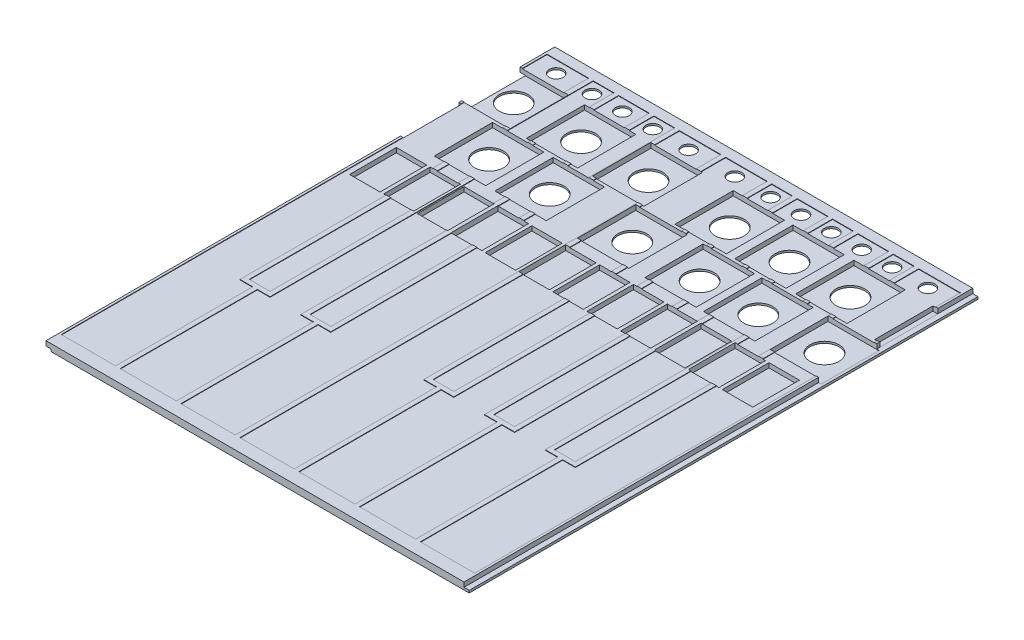
from build123d import *
from OCP.BRepAlgoAPI import BRepAlgoAPI_Cut
from OCP.TopTools import TopTools_ListOfShape

# Parameters (mm, degrees)
ESQUISSE8_W                   = 183
ESQUISSE8_H                   = 220
BOSS_EXTRU_2_DEPTH            = 3
ENL_V_MAT_EXTRU_8_DEPTH       = 0.2
ESQUISSE14_R                  = 3
ENL_V_MAT_EXTRU_9_DEPTH       = 10
ENL_V_MAT_EXTRU_10_DEPTH      = 2
ENL_V_MAT_EXTRU_10_DEPTH_BACK = 2
ESQUISSE15_W                  = 22.2
ESQUISSE15_H                  = 25.2
ESQUISSE16_R                  = 6.25
ENL_V_MAT_EXTRU_11_DEPTH      = 2
ESQUISSE21_W                  = 10
ESQUISSE21_H                  = 10
ENL_V_MAT_EXTRU_16_DEPTH      = 2
ESQUISSE22_W                  = 2.27
ESQUISSE22_H                  = 220
ENL_V_MAT_EXTRU_17_DEPTH      = 2
ENL_V_MAT_EXTRU_18_DEPTH      = 8
ENL_V_MAT_EXTRU_18_DEPTH_BACK = 1
ESQUISSE24_W                  = 1.110133424
ESQUISSE24_H                  = 25.2
ESQUISSE25_W                  = 25.2
ESQUISSE25_H                  = 0.8
BOSS_EXTRU_3_DEPTH            = 1.11
ENL_V_MAT_EXTRU_19_DEPTH      = 2
ENL_V_MAT_EXTRU_19_DEPTH_BACK = 2
ESQUISSE26_W                  = 2.2
ESQUISSE26_H                  = 25.2
ENL_V_MAT_EXTRU_20_DEPTH      = 2
ENL_V_MAT_EXTRU_20_DEPTH_BACK = 2
ESQUISSE27_W                  = 13.15
ESQUISSE27_H                  = 20.2
ESQUISSE31_W                  = 2.2
ESQUISSE31_H                  = 220
ENL_V_MAT_EXTRU_21_DEPTH      = 1


with BuildPart() as part:
    # Esquisse8 → Boss.-Extru.2 (new body)
    with BuildSketch(Plane(origin=(0, 0, 0), x_dir=(1, 0, 0), z_dir=(0, 1, 0))):
        with Locations((72.399649681, 96.803146184)):
            Rectangle(ESQUISSE8_W, ESQUISSE8_H)
    extrude(amount=BOSS_EXTRU_2_DEPTH)

    # Esquisse12 → Enlèv. mat.-Extru.8 (cut)
    with BuildSketch(Plane(origin=(0, 3, 0), x_dir=(1, 0, 0), z_dir=(0, 1, 0))):
        Polygon((12.879649681, 130.440899541), (12.879649681, 202.420857883), (26.149649681, 202.420857883), (26.149649681, 130.260667419), (26.149649681, 52.257370763), (26.149649681, 51.694801106), (31.649649681, 51.694801106), (31.649649681, -7.579142117), (7.379649681, -7.579142117), (7.379649681, 51.694801106), (12.879649681, 51.694801106), align=None)
        Polygon((-18.100350319, 130.420857883), (-18.100350319, -7.579142117), (5.379649681, -7.579142117), (5.379649681, 51.694801106), (-0.120350319, 51.694801106), (-0.120350319, 52.257370763), (-0.120350319, 130.260667419), (-0.120350319, 202.420857883), (-18.100350319, 202.420857883), align=None)
        Polygon((1.879649681, 131.311963557), (1.879649681, 202.420857883), (10.879649681, 202.420857883), (10.879649681, 131.417561227), (10.879649681, 53.694801106), (1.879649681, 53.694801106), align=None)
        Polygon((28.149649681, 130.250637406), (28.149649681, 202.420857883), (37.149649681, 202.420857883), (37.149649681, 131.437602886), (37.149649681, 53.694801106), (28.149649681, 53.694801106), align=None)
        Polygon((57.129649681, -7.579142117), (33.649649681, -7.579142117), (33.649649681, 51.694801106), (39.149649681, 51.694801106), (39.149649681, 129.699920963), (39.149649681, 202.420857883), (57.129649681, 202.420857883), (57.129649681, 130.420857883), align=None)
        Polygon((59.129649681, 130.365885771), (59.129649681, -7.579142117), (82.609649681, -7.579142117), (82.609649681, 53.939328185), (77.109649681, 53.939328185), (77.109649681, 54.501897842), (77.109649681, 132.505194498), (77.109649681, 202.420857883), (59.129649681, 202.420857883), align=None)
        Polygon((79.109649681, 132.515206144), (79.109649681, 202.420857883), (88.109649681, 202.420857883), (88.109649681, 133.501897842), (88.109649681, 55.939328185), (79.109649681, 55.939328185), align=None)
        Polygon((90.109649681, 132.083134603), (90.109649681, 202.420857883), (103.379649681, 202.420857883), (103.379649681, 132.505194498), (103.379649681, 54.501897842), (103.379649681, 53.939328185), (108.879649681, 53.939328185), (108.879649681, -7.579142117), (84.609649681, -7.579142117), (84.609649681, 53.939328185), (90.109649681, 53.939328185), align=None)
        Polygon((105.379649681, 132.12190572), (105.379649681, 202.420857883), (114.379649681, 202.420857883), (114.379649681, 132.632997984), (114.379649681, 55.939328185), (105.379649681, 55.939328185), align=None)
        Polygon((116.379649681, 132.505194498), (116.379649681, 202.420857883), (129.649649681, 202.420857883), (129.649649681, 132.505194498), (129.649649681, 54.501897842), (129.649649681, 53.939328185), (135.149649681, 53.939328185), (135.149649681, -7.579142117), (110.879649681, -7.579142117), (110.879649681, 53.939328185), (116.379649681, 53.939328185), align=None)
        Polygon((131.649649681, 133.284493832), (131.649649681, 202.420857883), (140.649649681, 202.420857883), (140.649649681, 133.501897842), (140.649649681, 55.939328185), (131.649649681, 55.939328185), align=None)
        Polygon((160.629649681, -7.579142117), (137.149649681, -7.579142117), (137.149649681, 53.939328185), (142.649649681, 53.939328185), (142.649649681, 131.944448043), (142.649649681, 202.420857883), (160.629649681, 202.420857883), (160.629649681, 130.420857883), align=None)
    extrude(amount=-ENL_V_MAT_EXTRU_8_DEPTH, mode=Mode.SUBTRACT)

    # Esquisse14 → Enlèv. mat.-Extru.9 (cut)
    with BuildSketch(Plane(origin=(0, 2.8, 0), x_dir=(1, 0, 0), z_dir=(0, 1, 0))):
        with Locations((-9.110350319, 197.420857883)):
            Circle(ESQUISSE14_R)
        with Locations((6.379649681, 197.420857883)):
            Circle(ESQUISSE14_R)
        with Locations((19.514649681, 197.420857883)):
            Circle(ESQUISSE14_R)
        with Locations((32.649649681, 197.420857883)):
            Circle(ESQUISSE14_R)
        with Locations((48.139649681, 197.420857883)):
            Circle(ESQUISSE14_R)
        with Locations((68.119649681, 197.420857883)):
            Circle(ESQUISSE14_R)
        with Locations((83.609649681, 197.420857883)):
            Circle(ESQUISSE14_R)
        with Locations((96.744649681, 197.420857883)):
            Circle(ESQUISSE14_R)
        with Locations((109.879649681, 197.420857883)):
            Circle(ESQUISSE14_R)
        with Locations((123.014649681, 197.420857883)):
            Circle(ESQUISSE14_R)
        with Locations((136.149649681, 197.420857883)):
            Circle(ESQUISSE14_R)
        with Locations((151.639649681, 197.420857883)):
            Circle(ESQUISSE14_R)
    extrude(amount=-ENL_V_MAT_EXTRU_9_DEPTH, mode=Mode.SUBTRACT)

    # Esquisse15 → Enlèv. mat.-Extru.10 (cut, two sides: drawn at the far end of the back side and taken through both)
    with BuildSketch(Plane(origin=(0, 2.8, 0), x_dir=(1, 0, 0), z_dir=(0, 1, 0)).offset(-ENL_V_MAT_EXTRU_10_DEPTH_BACK)):
        with Locations((6.594916238, 152.703146184)):
            Rectangle(ESQUISSE15_W, ESQUISSE15_H)
        with Locations((-9.241013815, 179.203146184)):
            Rectangle(ESQUISSE15_W, ESQUISSE15_H)
        with Locations((19.872804947, 179.203146184)):
            Rectangle(ESQUISSE15_W, ESQUISSE15_H)
        with Locations((32.799712013, 152.703146184)):
            Rectangle(ESQUISSE15_W, ESQUISSE15_H)
        with Locations((48.52607521, 179.203146184)):
            Rectangle(ESQUISSE15_W, ESQUISSE15_H)
        with Locations((68.522744895, 152.703146184)):
            Rectangle(ESQUISSE15_W, ESQUISSE15_H)
        with Locations((84.163003673, 179.203146184)):
            Rectangle(ESQUISSE15_W, ESQUISSE15_H)
        with Locations((97.631784342, 152.703146184)):
            Rectangle(ESQUISSE15_W, ESQUISSE15_H)
        with Locations((109.980524553, 179.203146184)):
            Rectangle(ESQUISSE15_W, ESQUISSE15_H)
        with Locations((123.01085971, 152.703146184)):
            Rectangle(ESQUISSE15_W, ESQUISSE15_H)
        with Locations((136.337943762, 179.203146184)):
            Rectangle(ESQUISSE15_W, ESQUISSE15_H)
        with Locations((151.639783105, 152.703146184)):
            Rectangle(ESQUISSE15_W, ESQUISSE15_H)
    extrude(amount=ENL_V_MAT_EXTRU_10_DEPTH + ENL_V_MAT_EXTRU_10_DEPTH_BACK, mode=Mode.SUBTRACT)

    # Esquisse16 → Enlèv. mat.-Extru.11 (cut)
    with BuildSketch(Plane(origin=(0, 0.8, 0), x_dir=(1, 0, 0), z_dir=(0, 1, 0))):
        with Locations((19.872804947, 179.203146184)):
            Circle(ESQUISSE16_R)
        with Locations((49.032873637, 179.203146184)):
            Circle(ESQUISSE16_R)
        with Locations((84.163003673, 179.203146184)):
            Circle(ESQUISSE16_R)
        with Locations((109.980524553, 179.203146184)):
            Circle(ESQUISSE16_R)
        with Locations((136.337943762, 179.203146184)):
            Circle(ESQUISSE16_R)
        with Locations((6.594916238, 152.703146184)):
            Circle(ESQUISSE16_R)
        with Locations((32.799712013, 152.703146184)):
            Circle(ESQUISSE16_R)
        with Locations((68.522744895, 152.703146184)):
            Circle(ESQUISSE16_R)
        with Locations((97.631784342, 152.703146184)):
            Circle(ESQUISSE16_R)
        with Locations((123.01085971, 152.703146184)):
            Circle(ESQUISSE16_R)
        with Locations((151.639783105, 152.703146184)):
            Circle(ESQUISSE16_R)
        with Locations((-9.241013815, 179.203146184)):
            Circle(ESQUISSE16_R)
    extrude(amount=-ENL_V_MAT_EXTRU_11_DEPTH, mode=Mode.SUBTRACT)

    # Esquisse21 → Enlèv. mat.-Extru.16 (cut)
    with BuildSketch(Plane(origin=(0, 0, 0), x_dir=(-1, 0, 0), z_dir=(0, -1, 0))):
        with Locations((9.110350319, 197.420857883)):
            Rectangle(ESQUISSE21_W, ESQUISSE21_H)
        with Locations((-6.379649681, 197.420857883)):
            Rectangle(ESQUISSE21_W, ESQUISSE21_H)
        with Locations((-19.514649681, 197.420857883)):
            Rectangle(ESQUISSE21_W, ESQUISSE21_H)
        with Locations((-32.649649681, 197.420857883)):
            Rectangle(ESQUISSE21_W, ESQUISSE21_H)
        with Locations((-48.139649681, 197.420857883)):
            Rectangle(ESQUISSE21_W, ESQUISSE21_H)
        with Locations((-68.119649681, 197.420857883)):
            Rectangle(ESQUISSE21_W, ESQUISSE21_H)
        with Locations((-83.609649681, 197.420857883)):
            Rectangle(ESQUISSE21_W, ESQUISSE21_H)
        with Locations((-96.744649681, 197.420857883)):
            Rectangle(ESQUISSE21_W, ESQUISSE21_H)
        with Locations((-109.879649681, 197.420857883)):
            Rectangle(ESQUISSE21_W, ESQUISSE21_H)
        with Locations((-123.014649681, 197.420857883)):
            Rectangle(ESQUISSE21_W, ESQUISSE21_H)
        with Locations((-136.149649681, 197.420857883)):
            Rectangle(ESQUISSE21_W, ESQUISSE21_H)
        with Locations((-151.639649681, 197.420857883)):
            Rectangle(ESQUISSE21_W, ESQUISSE21_H)
    extrude(amount=-ENL_V_MAT_EXTRU_16_DEPTH, mode=Mode.SUBTRACT)

    # Esquisse22 → Enlèv. mat.-Extru.17 (cut)
    with BuildSketch(Plane(origin=(0, 3, 0), x_dir=(1, 0, 0), z_dir=(0, 1, 0))):
        with Locations((162.764649681, 96.803146184)):
            Rectangle(ESQUISSE22_W, ESQUISSE22_H)
    extrude(amount=-ENL_V_MAT_EXTRU_17_DEPTH, mode=Mode.SUBTRACT)


with BuildPart() as enl_v_mat_extru_18_tool:
    # Esquisse24 → Enlèv. mat.-Extru.18 (new, two sides: drawn at the far end of the back side and taken through both)
    with BuildSketch(Plane(origin=(0, 0.8, 0), x_dir=(1, 0, 0), z_dir=(0, 1, 0)).offset(-ENL_V_MAT_EXTRU_18_DEPTH_BACK)):
        with Locations((-18.545277738, 152.703146184)):
            Rectangle(ESQUISSE24_W, ESQUISSE24_H)
    extrude(amount=ENL_V_MAT_EXTRU_18_DEPTH + ENL_V_MAT_EXTRU_18_DEPTH_BACK)


with BuildPart() as part_1:
    add(part.part)

    # Enlèv. mat.-Extru.18: cut by enl_v_mat_extru_18_tool, with a tolerance
    enl_v_mat_extru_18_stock = TopTools_ListOfShape()
    enl_v_mat_extru_18_stock.Append(part_1.part.wrapped)
    enl_v_mat_extru_18_tools = TopTools_ListOfShape()
    enl_v_mat_extru_18_tools.Append(enl_v_mat_extru_18_tool.part.wrapped)
    enl_v_mat_extru_18_cut = BRepAlgoAPI_Cut()
    enl_v_mat_extru_18_cut.SetArguments(enl_v_mat_extru_18_stock)
    enl_v_mat_extru_18_cut.SetTools(enl_v_mat_extru_18_tools)
    enl_v_mat_extru_18_cut.SetFuzzyValue(0.00001)
    enl_v_mat_extru_18_cut.Build()
    add(Compound.cast(enl_v_mat_extru_18_cut.Shape()).solids(), mode=Mode.REPLACE)

    # Esquisse25 → Boss.-Extru.3 (add)
    with BuildSketch(Plane.ZY.offset(17.990211026)):
        with Locations((-152.703146184, 0.4)):
            Rectangle(ESQUISSE25_W, ESQUISSE25_H)
    extrude(amount=BOSS_EXTRU_3_DEPTH)

    # Esquisse26 → Enlèv. mat.-Extru.19 (cut, two sides: drawn at the far end of the back side and taken through both)
    with BuildSketch(Plane(origin=(0, 2.8, 0), x_dir=(1, 0, 0), z_dir=(0, 1, 0)).offset(-ENL_V_MAT_EXTRU_19_DEPTH_BACK)):
        with Locations((160.529649681, 179.203146184)):
            Rectangle(ESQUISSE26_W, ESQUISSE26_H)
    extrude(amount=ENL_V_MAT_EXTRU_19_DEPTH + ENL_V_MAT_EXTRU_19_DEPTH_BACK, mode=Mode.SUBTRACT)

    # Esquisse27 → Enlèv. mat.-Extru.20 (cut, two sides: drawn at the far end of the back side and taken through both)
    with BuildSketch(Plane(origin=(0, 2.8, 0), x_dir=(1, 0, 0), z_dir=(0, 1, 0)).offset(-ENL_V_MAT_EXTRU_20_DEPTH_BACK)):
        with Locations((5.303374385, 125.003146184)):
            Rectangle(ESQUISSE27_W, ESQUISSE27_H)
        with Locations((-9.346625615, 125.003146184)):
            Rectangle(ESQUISSE27_W, ESQUISSE27_H)
        with Locations((19.953374385, 125.003146184)):
            Rectangle(ESQUISSE27_W, ESQUISSE27_H)
        with Locations((34.603374385, 125.046529501)):
            Rectangle(ESQUISSE27_W, ESQUISSE27_H)
        with Locations((49.253374385, 125.003146184)):
            Rectangle(ESQUISSE27_W, ESQUISSE27_H)
        with Locations((63.903374385, 125.003146184)):
            Rectangle(ESQUISSE27_W, ESQUISSE27_H)
        with Locations((78.553374385, 125.003146184)):
            Rectangle(ESQUISSE27_W, ESQUISSE27_H)
        with Locations((93.203374385, 125.003146184)):
            Rectangle(ESQUISSE27_W, ESQUISSE27_H)
        with Locations((107.853374385, 125.003146184)):
            Rectangle(ESQUISSE27_W, ESQUISSE27_H)
        with Locations((122.503374385, 125.003146184)):
            Rectangle(ESQUISSE27_W, ESQUISSE27_H)
        with Locations((137.153374385, 125.003146184)):
            Rectangle(ESQUISSE27_W, ESQUISSE27_H)
        with Locations((151.803374385, 125.003146184)):
            Rectangle(ESQUISSE27_W, ESQUISSE27_H)
    extrude(amount=ENL_V_MAT_EXTRU_20_DEPTH + ENL_V_MAT_EXTRU_20_DEPTH_BACK, mode=Mode.SUBTRACT)

    # Esquisse31 → Enlèv. mat.-Extru.21 (cut)
    with BuildSketch(Plane(origin=(0, 0, 0), x_dir=(-1, 0, 0), z_dir=(0, -1, 0))):
        with Locations((18.000350319, 96.803146184)):
            Rectangle(ESQUISSE31_W, ESQUISSE31_H)
    extrude(amount=-ENL_V_MAT_EXTRU_21_DEPTH, mode=Mode.SUBTRACT)


solid = part_1.part
